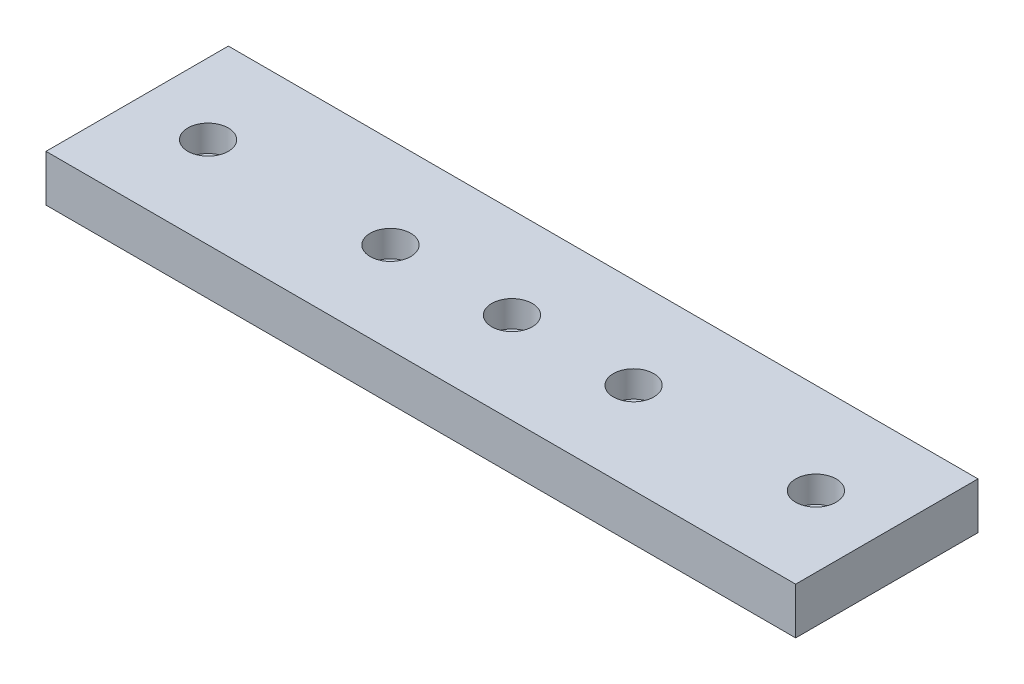
from build123d import *

# Parameters (mm, degrees)
SKETCH_1_W                          = 370
SKETCH_1_H                          = 90
EXTRUDE_1_DEPTH                     = 23
HOLE_WIZARD_M4_1_D                  = 13.5
HOLE_WIZARD_M4_1_CBORE_D            = 20
HOLE_WIZARD_M4_1_CBORE_DEPTH        = 13
PATTERN_LINEAR_1_COUNT              = 2
PATTERN_LINEAR_1_PITCH              = 90
PATTERN_LINEAR_2_COPY_1_D           = 13.5
PATTERN_LINEAR_2_COPY_1_CBORE_D     = 20
PATTERN_LINEAR_2_COPY_1_CBORE_DEPTH = 13
PATTERN_LINEAR_2_COPY_2_D           = 13.5
PATTERN_LINEAR_2_COPY_2_CBORE_D     = 20
PATTERN_LINEAR_2_COPY_2_CBORE_DEPTH = 13
PATTERN_START                       = 10
PATTERN_LINEAR_3_OUTLINE_R          = 10
PATTERN_LINEAR_3_DEPTH              = 13
PATTERN_LINEAR_3_2_OUTLINE_R        = 6.75
PATTERN_LINEAR_3_2_DEPTH            = 10


# Read off the part's stored shape, not the designer's step: 阵列(线性)3
with BuildPart() as part:
    # 草图1 → 凸台-拉伸1 (new body)
    with BuildSketch(Plane(origin=(0, 0, 0), x_dir=(1, 0, 0), z_dir=(0, 1, 0))):
        Rectangle(SKETCH_1_W, SKETCH_1_H)
    extrude(amount=EXTRUDE_1_DEPTH)

    # M4 六角头螺栓的柱形沉头孔1 (through all)
    with Locations(Plane(origin=(0, 23, 0), x_dir=(1, 0, 0), z_dir=(0, 1, 0))):
        with Locations((-150, 0)):
            hole_wizard_m4_1 = CounterBoreHole(HOLE_WIZARD_M4_1_D / 2, HOLE_WIZARD_M4_1_CBORE_D / 2, HOLE_WIZARD_M4_1_CBORE_DEPTH)

    # 阵列(线性)1: M4 六角头螺栓的柱形沉头孔1 ×2
    with Locations(*[(i * PATTERN_LINEAR_1_PITCH, 0, 0) for i in range(1, PATTERN_LINEAR_1_COUNT)]):
        add(hole_wizard_m4_1, mode=Mode.SUBTRACT)

    # 阵列(线性)2 copy 1 (through all)
    with Locations(Plane(origin=(150, 23, 0), x_dir=(1, 0, 0), z_dir=(0, 1, 0))):
        with Locations((-150, 0)):
            CounterBoreHole(PATTERN_LINEAR_2_COPY_1_D / 2, PATTERN_LINEAR_2_COPY_1_CBORE_D / 2, PATTERN_LINEAR_2_COPY_1_CBORE_DEPTH)

    # 阵列(线性)2 copy 2 (through all)
    with Locations(Plane(origin=(210, 23, 0), x_dir=(1, 0, 0), z_dir=(0, 1, 0))):
        with Locations((-150, 0)):
            CounterBoreHole(PATTERN_LINEAR_2_COPY_2_D / 2, PATTERN_LINEAR_2_COPY_2_CBORE_D / 2, PATTERN_LINEAR_2_COPY_2_CBORE_DEPTH)

    # 阵列(线性)3 outline → 阵列(线性)3 (cut)
    with BuildSketch(Plane(origin=(0, 0, 0), x_dir=(1, 0, 0), z_dir=(0, 1, 0)).offset(PATTERN_START)):
        with Locations((150, 0)):
            Circle(PATTERN_LINEAR_3_OUTLINE_R)
    extrude(amount=PATTERN_LINEAR_3_DEPTH, mode=Mode.SUBTRACT)

    # Pattern Linear 3 2 outline → Pattern Linear 3 2 (cut)
    with BuildSketch(Plane(origin=(0, 0, 0), x_dir=(1, 0, 0), z_dir=(0, 1, 0))):
        with Locations((150, 0)):
            Circle(PATTERN_LINEAR_3_2_OUTLINE_R)
    extrude(amount=PATTERN_LINEAR_3_2_DEPTH, mode=Mode.SUBTRACT)


solid = part.part
